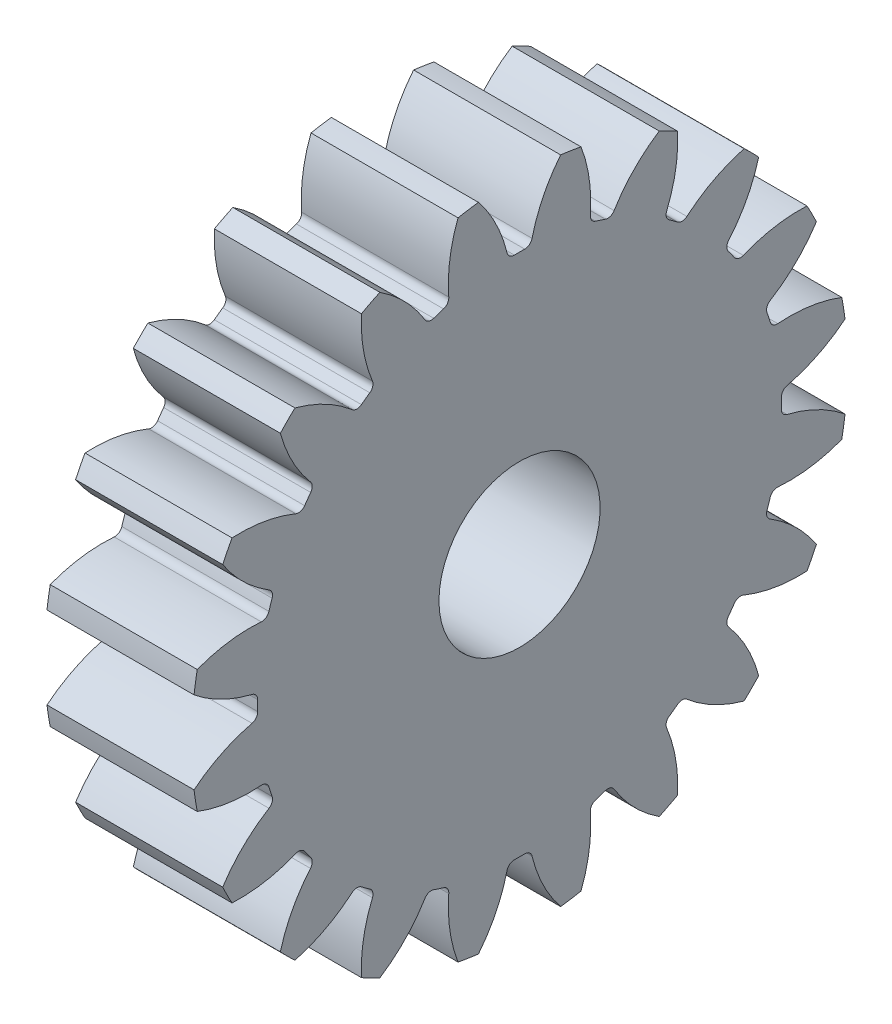
from build123d import *

# Parameters (mm, degrees)
BASPROSKE_W                     = 4
BASPROSKE_H                     = 11.154266119
TOOTHCUTRH_PITCH                = 397.467935473
TOOTHCUTRH_HEIGHT               = 4
TOOTHCUTRH_RADIUS               = 11.154266119
TOOTHCUTRH_START_ANGLE          = -90
TEETHCUTSRH_COUNT               = 20
TEETHCUTSRH_ANGLE               = 342
BORSKE_R                        = 3
BORE_DEPTH                      = 62.5000025
SKIZZE1_R                       = 4.15
LOCH_DEPTH                      = 17.244020749
LASCHEN_RUND_DEPTH              = 1.7
LASCHE_GROSS_ECKIG_DEPTH        = 1.7
SCHNITT_LINEAR_AUSTRAGEN4_DEPTH = 1.7
SKIZZE7_R                       = 1
LOCH_OPTION_DEPTH               = 17.244021148
KREISMUSTER1_COUNT              = 6
BOSS_EXTRUDE1_DEPTH             = 5
SKETCH5_R                       = 18.56871855
CUT_EXTRUDE1_DEPTH              = 4
SKETCH7_R                       = 2.245356676
CUT_EXTRUDE2_DEPTH              = 4
SCALE1_SCALE                    = 1.46
CUT_EXTRUDE3_DEPTH              = 10
CUT_EXTRUDE3_DEPTH_BACK         = 10
SKETCH9_R                       = 4


with BuildPart() as part:
    # BasProSke → Base-Revolve (revolve)
    with BuildSketch(Plane(origin=(0, 0, 0), x_dir=(1, 0, 0), z_dir=(0, 1, 0)), mode=Mode.PRIVATE) as base_revolve_sk:
        with Locations((2, 5.57713306)):
            Rectangle(BASPROSKE_W, BASPROSKE_H)
    revolve(base_revolve_sk.sketch.rotate(Axis((-10, 0, 0), (1, 0, 0)), 180), axis=Axis((-10, 0, 0), (1, 0, 0)))

    # ToothCutRH: sweep along a helix
    with BuildLine() as toothcutrh_path:
        add(Helix(TOOTHCUTRH_PITCH, TOOTHCUTRH_HEIGHT, TOOTHCUTRH_RADIUS, center=(0, 0, 0), direction=(1, 0, 0), mode=Mode.PRIVATE).rotate(Axis((0, 0, 0), (1, 0, 0)), TOOTHCUTRH_START_ANGLE))
    # TooCutSkeRH → ToothCutRH (sweep, cut)
    with BuildSketch(Plane(origin=(0, 0, 0), x_dir=(0, 0, -1), z_dir=(1, 0, 0))):
        with BuildLine():
            ThreePointArc((0.176132075, 8.902523946), (0, 8.904266119), (-0.176132075, 8.902523946))
            ThreePointArc((-0.176132075, 8.902523946), (-0.334445137, 8.954765617), (-0.425110314, 9.094665737))
            ThreePointArc((-0.425110314, 9.094665737), (-0.893917111, 10.312771472), (-1.662006655, 11.368043876))
            ThreePointArc((-1.662006655, 11.368043876), (0, 11.488894102), (1.662006655, 11.368043876))
            ThreePointArc((1.662006655, 11.368043876), (0.893917111, 10.312771472), (0.425110314, 9.094665737))
            ThreePointArc((0.425110314, 9.094665737), (0.334445137, 8.954765617), (0.176132075, 8.902523946))
        make_face()
    toothcutrh = sweep(path=toothcutrh_path.line, is_frenet=True, mode=Mode.SUBTRACT)

    # TeethCutsRH: ToothCutRH ×20 about axis
    teethcutsrh_axis = Axis((-10, 0, 0), (1, 0, 0))
    for i in range(1, TEETHCUTSRH_COUNT):
        add(toothcutrh.rotate(teethcutsrh_axis, i * TEETHCUTSRH_ANGLE / (TEETHCUTSRH_COUNT - 1)), mode=Mode.SUBTRACT)

    # BorSke → Bore (cut, symmetric)
    with BuildSketch(Plane(origin=(0, 0, 0), x_dir=(0, 0, -1), z_dir=(1, 0, 0))):
        with Locations(Location((0, 0, 0), (0, 0, 180))):
            Circle(BORSKE_R)
    extrude(amount=BORE_DEPTH, both=True, mode=Mode.SUBTRACT)

    # Skizze1 → loch (cut, through all)
    with BuildSketch(Plane(origin=(4, 0, 0), x_dir=(0, 0, -1), z_dir=(1, 0, 0))):
        Circle(SKIZZE1_R)
    extrude(amount=-LOCH_DEPTH, mode=Mode.SUBTRACT)

    # Skizze2 → laschen rund (cut)
    with BuildSketch(Plane(origin=(4, 0, 0), x_dir=(0, 0, -1), z_dir=(1, 0, 0))):
        with BuildLine():
            Line((-6.4, 2.15), (6.4, 2.15))
            ThreePointArc((6.4, 2.15), (8.55, 0), (6.4, -2.15))
            Line((6.4, -2.15), (-6.4, -2.15))
            ThreePointArc((-6.4, -2.15), (-8.55, 0), (-6.4, 2.15))
        make_face()
    extrude(amount=-LASCHEN_RUND_DEPTH, mode=Mode.SUBTRACT)

    # Skizze5 → lasche gross eckig (cut)
    with BuildSketch(Plane(origin=(4, 0, 0), x_dir=(0, 0, -1), z_dir=(1, 0, 0))):
        Polygon((-3.125502306, 7.65), (-3.6, 2.15), (3.6, 2.15), (3.125502306, 7.65), align=None)
    extrude(amount=-LASCHE_GROSS_ECKIG_DEPTH, mode=Mode.SUBTRACT)

    # Skizze6 → Schnitt-Linear austragen4 (cut)
    with BuildSketch(Plane(origin=(4, 0, 0), x_dir=(0, 0, -1), z_dir=(1, 0, 0))):
        Polygon((-3.144670941, -2.194021559), (-2.740477844, -7.332363985), (2.804249033, -7.332363985), (3.255322421, -2.203238944), align=None)
    extrude(amount=-SCHNITT_LINEAR_AUSTRAGEN4_DEPTH, mode=Mode.SUBTRACT)

    # Skizze7 → loch option (cut, through all)
    with BuildSketch(Plane.ZY):
        with Locations((1.333158904, -6.48479628)):
            Circle(SKIZZE7_R)
    loch_option = extrude(amount=-LOCH_OPTION_DEPTH, mode=Mode.SUBTRACT)

    # Kreismuster1: loch option ×6 about axis
    kreismuster1_axis = Axis((0, 0, 0), (1, 0, 0))
    for i in range(1, KREISMUSTER1_COUNT):
        add(loch_option.rotate(kreismuster1_axis, i * 360 / KREISMUSTER1_COUNT), mode=Mode.SUBTRACT)

    # Sketch4 → Boss-Extrude1 (add)
    with BuildSketch(Plane.ZY):
        with BuildLine():
            ThreePointArc((-1.397458918, 11.06637977), (-1.744911653, 11.016938593), (-2.090637005, 10.956591147))
            ThreePointArc((-2.090637005, 10.956591147), (-2.369428009, 9.886302254), (-2.406102336, 8.780907424))
            ThreePointArc((-2.406102336, 8.780907424), (-2.44909853, 8.619837423), (-2.583519634, 8.521231215))
            ThreePointArc((-2.583519634, 8.521231215), (-2.751569553, 8.468460315), (-2.91854275, 8.412375606))
            ThreePointArc((-2.91854275, 8.412375606), (-3.085250983, 8.413138961), (-3.214710205, 8.518174801))
            ThreePointArc((-3.214710205, 8.518174801), (-3.894115139, 9.390901375), (-4.748761826, 10.092914038))
            ThreePointArc((-4.748761826, 10.092914038), (-5.06393085, 9.938523884), (-5.374086811, 9.774295043))
            ThreePointArc((-5.374086811, 9.774295043), (-5.308495356, 8.670238659), (-5.001788926, 7.607612712))
            ThreePointArc((-5.001788926, 7.607612712), (-4.992907368, 7.441139484), (-5.090278441, 7.305821001))
            ThreePointArc((-5.090278441, 7.305821001), (-5.233796307, 7.203702613), (-5.375266126, 7.098765329))
            ThreePointArc((-5.375266126, 7.098765329), (-5.534050967, 7.047975646), (-5.689631863, 7.107865566))
            ThreePointArc((-5.689631863, 7.107865566), (-6.605471695, 7.727930191), (-7.635222839, 8.131483558))
            ThreePointArc((-7.635222839, 8.131483558), (-7.887257212, 7.887257212), (-8.131483558, 7.635222839))
            ThreePointArc((-8.131483558, 7.635222839), (-7.727930191, 6.605471695), (-7.107865566, 5.689631863))
            ThreePointArc((-7.107865566, 5.689631863), (-7.047975646, 5.534050967), (-7.098765329, 5.375266126))
            ThreePointArc((-7.098765329, 5.375266126), (-7.203702613, 5.233796307), (-7.305821001, 5.090278441))
            ThreePointArc((-7.305821001, 5.090278441), (-7.441139484, 4.992907368), (-7.607612712, 5.001788926))
            ThreePointArc((-7.607612712, 5.001788926), (-8.670238659, 5.308495356), (-9.774295043, 5.374086811))
            ThreePointArc((-9.774295043, 5.374086811), (-9.938523884, 5.06393085), (-10.092914038, 4.748761826))
            ThreePointArc((-10.092914038, 4.748761826), (-9.390901375, 3.894115139), (-8.518174801, 3.214710205))
            ThreePointArc((-8.518174801, 3.214710205), (-8.413138961, 3.085250983), (-8.412375606, 2.91854275))
            ThreePointArc((-8.412375606, 2.91854275), (-8.468460315, 2.751569553), (-8.521231215, 2.583519634))
            ThreePointArc((-8.521231215, 2.583519634), (-8.619837423, 2.44909853), (-8.780907424, 2.406102336))
            ThreePointArc((-8.780907424, 2.406102336), (-9.886302254, 2.369428009), (-10.956591147, 2.090637005))
            ThreePointArc((-10.956591147, 2.090637005), (-11.016938593, 1.744911653), (-11.06637977, 1.397458918))
            ThreePointArc((-11.06637977, 1.397458918), (-10.134625703, 0.801575461), (-9.094665737, 0.425110314))
            ThreePointArc((-9.094665737, 0.425110314), (-8.954765617, 0.334445137), (-8.902523946, 0.176132075))
            ThreePointArc((-8.902523946, 0.176132075), (-8.904266119, 0), (-8.902523946, -0.176132075))
            ThreePointArc((-8.902523946, -0.176132075), (-8.954765617, -0.334445137), (-9.094665737, -0.425110314))
            ThreePointArc((-9.094665737, -0.425110314), (-10.134625703, -0.801575461), (-11.06637977, -1.397458918))
            ThreePointArc((-11.06637977, -1.397458918), (-11.016938593, -1.744911653), (-10.956591147, -2.090637005))
            ThreePointArc((-10.956591147, -2.090637005), (-9.886302254, -2.369428009), (-8.780907424, -2.406102336))
            ThreePointArc((-8.780907424, -2.406102336), (-8.619837423, -2.44909853), (-8.521231215, -2.583519634))
            ThreePointArc((-8.521231215, -2.583519634), (-8.468460315, -2.751569553), (-8.412375606, -2.91854275))
            ThreePointArc((-8.412375606, -2.91854275), (-8.413138961, -3.085250983), (-8.518174801, -3.214710205))
            ThreePointArc((-8.518174801, -3.214710205), (-9.390901375, -3.894115139), (-10.092914038, -4.748761826))
            ThreePointArc((-10.092914038, -4.748761826), (-9.938523884, -5.06393085), (-9.774295043, -5.374086811))
            ThreePointArc((-9.774295043, -5.374086811), (-8.670238659, -5.308495356), (-7.607612712, -5.001788926))
            ThreePointArc((-7.607612712, -5.001788926), (-7.441139484, -4.992907368), (-7.305821001, -5.090278441))
            ThreePointArc((-7.305821001, -5.090278441), (-7.203702613, -5.233796307), (-7.098765329, -5.375266126))
            ThreePointArc((-7.098765329, -5.375266126), (-7.047975646, -5.534050967), (-7.107865566, -5.689631863))
            ThreePointArc((-7.107865566, -5.689631863), (-7.727930191, -6.605471695), (-8.131483558, -7.635222839))
            ThreePointArc((-8.131483558, -7.635222839), (-7.887257212, -7.887257212), (-7.635222839, -8.131483558))
            ThreePointArc((-7.635222839, -8.131483558), (-6.605471695, -7.727930191), (-5.689631863, -7.107865566))
            ThreePointArc((-5.689631863, -7.107865566), (-5.534050967, -7.047975646), (-5.375266126, -7.098765329))
            ThreePointArc((-5.375266126, -7.098765329), (-5.233796307, -7.203702613), (-5.090278441, -7.305821001))
            ThreePointArc((-5.090278441, -7.305821001), (-4.992907368, -7.441139484), (-5.001788926, -7.607612712))
            ThreePointArc((-5.001788926, -7.607612712), (-5.308495356, -8.670238659), (-5.374086811, -9.774295043))
            ThreePointArc((-5.374086811, -9.774295043), (-5.06393085, -9.938523884), (-4.748761826, -10.092914038))
            ThreePointArc((-4.748761826, -10.092914038), (-3.894115139, -9.390901375), (-3.214710205, -8.518174801))
            ThreePointArc((-3.214710205, -8.518174801), (-3.085250983, -8.413138961), (-2.91854275, -8.412375606))
            ThreePointArc((-2.91854275, -8.412375606), (-2.751569553, -8.468460315), (-2.583519634, -8.521231215))
            ThreePointArc((-2.583519634, -8.521231215), (-2.44909853, -8.619837423), (-2.406102336, -8.780907424))
            ThreePointArc((-2.406102336, -8.780907424), (-2.369428009, -9.886302254), (-2.090637005, -10.956591147))
            ThreePointArc((-2.090637005, -10.956591147), (-1.744911653, -11.016938593), (-1.397458918, -11.06637977))
            ThreePointArc((-1.397458918, -11.06637977), (-0.801575461, -10.134625703), (-0.425110314, -9.094665737))
            ThreePointArc((-0.425110314, -9.094665737), (-0.334445137, -8.954765617), (-0.176132075, -8.902523946))
            ThreePointArc((-0.176132075, -8.902523946), (0, -8.904266119), (0.176132075, -8.902523946))
            ThreePointArc((0.176132075, -8.902523946), (0.334445137, -8.954765617), (0.425110314, -9.094665737))
            ThreePointArc((0.425110314, -9.094665737), (0.801575461, -10.134625703), (1.397458918, -11.06637977))
            ThreePointArc((1.397458918, -11.06637977), (1.744911653, -11.016938593), (2.090637005, -10.956591147))
            ThreePointArc((2.090637005, -10.956591147), (2.369428009, -9.886302254), (2.406102336, -8.780907424))
            ThreePointArc((2.406102336, -8.780907424), (2.44909853, -8.619837423), (2.583519634, -8.521231215))
            ThreePointArc((2.583519634, -8.521231215), (2.751569553, -8.468460315), (2.91854275, -8.412375606))
            ThreePointArc((2.91854275, -8.412375606), (3.085250983, -8.413138961), (3.214710205, -8.518174801))
            ThreePointArc((3.214710205, -8.518174801), (3.894115139, -9.390901375), (4.748761826, -10.092914038))
            ThreePointArc((4.748761826, -10.092914038), (5.06393085, -9.938523884), (5.374086811, -9.774295043))
            ThreePointArc((5.374086811, -9.774295043), (5.308495356, -8.670238659), (5.001788926, -7.607612712))
            ThreePointArc((5.001788926, -7.607612712), (4.992907368, -7.441139484), (5.090278441, -7.305821001))
            ThreePointArc((5.090278441, -7.305821001), (5.233796307, -7.203702613), (5.375266126, -7.098765329))
            ThreePointArc((5.375266126, -7.098765329), (5.534050967, -7.047975646), (5.689631863, -7.107865566))
            ThreePointArc((5.689631863, -7.107865566), (6.605471695, -7.727930191), (7.635222839, -8.131483558))
            ThreePointArc((7.635222839, -8.131483558), (7.887257212, -7.887257212), (8.131483558, -7.635222839))
            ThreePointArc((8.131483558, -7.635222839), (7.727930191, -6.605471695), (7.107865566, -5.689631863))
            ThreePointArc((7.107865566, -5.689631863), (7.047975646, -5.534050967), (7.098765329, -5.375266126))
            ThreePointArc((7.098765329, -5.375266126), (7.203702613, -5.233796307), (7.305821001, -5.090278441))
            ThreePointArc((7.305821001, -5.090278441), (7.441139484, -4.992907368), (7.607612712, -5.001788926))
            ThreePointArc((7.607612712, -5.001788926), (8.670238659, -5.308495356), (9.774295043, -5.374086811))
            ThreePointArc((9.774295043, -5.374086811), (9.938523884, -5.06393085), (10.092914038, -4.748761826))
            ThreePointArc((10.092914038, -4.748761826), (9.390901375, -3.894115139), (8.518174801, -3.214710205))
            ThreePointArc((8.518174801, -3.214710205), (8.413138961, -3.085250983), (8.412375606, -2.91854275))
            ThreePointArc((8.412375606, -2.91854275), (8.468460315, -2.751569553), (8.521231215, -2.583519634))
            ThreePointArc((8.521231215, -2.583519634), (8.619837423, -2.44909853), (8.780907424, -2.406102336))
            ThreePointArc((8.780907424, -2.406102336), (9.886302254, -2.369428009), (10.956591147, -2.090637005))
            ThreePointArc((10.956591147, -2.090637005), (11.016938593, -1.744911653), (11.06637977, -1.397458918))
            ThreePointArc((11.06637977, -1.397458918), (10.134625703, -0.801575461), (9.094665737, -0.425110314))
            ThreePointArc((9.094665737, -0.425110314), (8.954765617, -0.334445137), (8.902523946, -0.176132075))
            ThreePointArc((8.902523946, -0.176132075), (8.904266119, 0), (8.902523946, 0.176132075))
            ThreePointArc((8.902523946, 0.176132075), (8.954765617, 0.334445137), (9.094665737, 0.425110314))
            ThreePointArc((9.094665737, 0.425110314), (10.134625703, 0.801575461), (11.06637977, 1.397458918))
            ThreePointArc((11.06637977, 1.397458918), (11.016938593, 1.744911653), (10.956591147, 2.090637005))
            ThreePointArc((10.956591147, 2.090637005), (9.886302254, 2.369428009), (8.780907424, 2.406102336))
            ThreePointArc((8.780907424, 2.406102336), (8.619837423, 2.44909853), (8.521231215, 2.583519634))
            ThreePointArc((8.521231215, 2.583519634), (8.468460315, 2.751569553), (8.412375606, 2.91854275))
            ThreePointArc((8.412375606, 2.91854275), (8.413138961, 3.085250983), (8.518174801, 3.214710205))
            ThreePointArc((8.518174801, 3.214710205), (9.390901375, 3.894115139), (10.092914038, 4.748761826))
            ThreePointArc((10.092914038, 4.748761826), (9.938523884, 5.06393085), (9.774295043, 5.374086811))
            ThreePointArc((9.774295043, 5.374086811), (8.670238659, 5.308495356), (7.607612712, 5.001788926))
            ThreePointArc((7.607612712, 5.001788926), (7.441139484, 4.992907368), (7.305821001, 5.090278441))
            ThreePointArc((7.305821001, 5.090278441), (7.203702613, 5.233796307), (7.098765329, 5.375266126))
            ThreePointArc((7.098765329, 5.375266126), (7.047975646, 5.534050967), (7.107865566, 5.689631863))
            ThreePointArc((7.107865566, 5.689631863), (7.727930191, 6.605471695), (8.131483558, 7.635222839))
            ThreePointArc((8.131483558, 7.635222839), (7.887257212, 7.887257212), (7.635222839, 8.131483558))
            ThreePointArc((7.635222839, 8.131483558), (6.605471695, 7.727930191), (5.689631863, 7.107865566))
            ThreePointArc((5.689631863, 7.107865566), (5.534050967, 7.047975646), (5.375266126, 7.098765329))
            ThreePointArc((5.375266126, 7.098765329), (5.233796307, 7.203702613), (5.090278441, 7.305821001))
            ThreePointArc((5.090278441, 7.305821001), (4.992907368, 7.441139484), (5.001788926, 7.607612712))
            ThreePointArc((5.001788926, 7.607612712), (5.308495356, 8.670238659), (5.374086811, 9.774295043))
            ThreePointArc((5.374086811, 9.774295043), (5.06393085, 9.938523884), (4.748761826, 10.092914038))
            ThreePointArc((4.748761826, 10.092914038), (3.894115139, 9.390901375), (3.214710205, 8.518174801))
            ThreePointArc((3.214710205, 8.518174801), (3.085250983, 8.413138961), (2.91854275, 8.412375606))
            ThreePointArc((2.91854275, 8.412375606), (2.751569553, 8.468460315), (2.583519634, 8.521231215))
            ThreePointArc((2.583519634, 8.521231215), (2.44909853, 8.619837423), (2.406102336, 8.780907424))
            ThreePointArc((2.406102336, 8.780907424), (2.369428009, 9.886302254), (2.090637005, 10.956591147))
            ThreePointArc((2.090637005, 10.956591147), (1.744911653, 11.016938593), (1.397458918, 11.06637977))
            ThreePointArc((1.397458918, 11.06637977), (0.801575461, 10.134625703), (0.425110314, 9.094665737))
            ThreePointArc((0.425110314, 9.094665737), (0.334445137, 8.954765617), (0.176132075, 8.902523946))
            ThreePointArc((0.176132075, 8.902523946), (0, 8.904266119), (-0.176132075, 8.902523946))
            ThreePointArc((-0.176132075, 8.902523946), (-0.334445137, 8.954765617), (-0.425110314, 9.094665737))
            ThreePointArc((-0.425110314, 9.094665737), (-0.801575461, 10.134625703), (-1.397458918, 11.06637977))
        make_face()
    extrude(amount=BOSS_EXTRUDE1_DEPTH)

    # Sketch5 → Cut-Extrude1 (cut)
    with BuildSketch(Plane(origin=(0, 0, 0), x_dir=(0, 0, -1), z_dir=(1, 0, 0))):
        Circle(SKETCH5_R)
    extrude(amount=CUT_EXTRUDE1_DEPTH, mode=Mode.SUBTRACT)

    # Sketch7 → Cut-Extrude2 (cut)
    with BuildSketch(Plane(origin=(0, 0, 0), x_dir=(0, 0, -1), z_dir=(1, 0, 0))):
        Circle(SKETCH7_R)
    extrude(amount=-CUT_EXTRUDE2_DEPTH, mode=Mode.SUBTRACT)


with BuildPart() as part_1:
    # Scale1: scaled about (-2.5206059, 0, 0)
    add(part.part.scale(SCALE1_SCALE).moved(Location((1.159478714, 0, 0))))

    # Sketch9 → Cut-Extrude3 (cut, two sides: drawn at the far end of the back side and taken through both)
    with BuildSketch(Plane(origin=(-4.680521286, 0, 0), x_dir=(0, 0, -1), z_dir=(1, 0, 0)).offset(-CUT_EXTRUDE3_DEPTH_BACK)):
        with Locations(Location((0, 0, 0), (0, 0, 180))):
            Circle(SKETCH9_R)
    extrude(amount=CUT_EXTRUDE3_DEPTH + CUT_EXTRUDE3_DEPTH_BACK, mode=Mode.SUBTRACT)


solid = part_1.part
